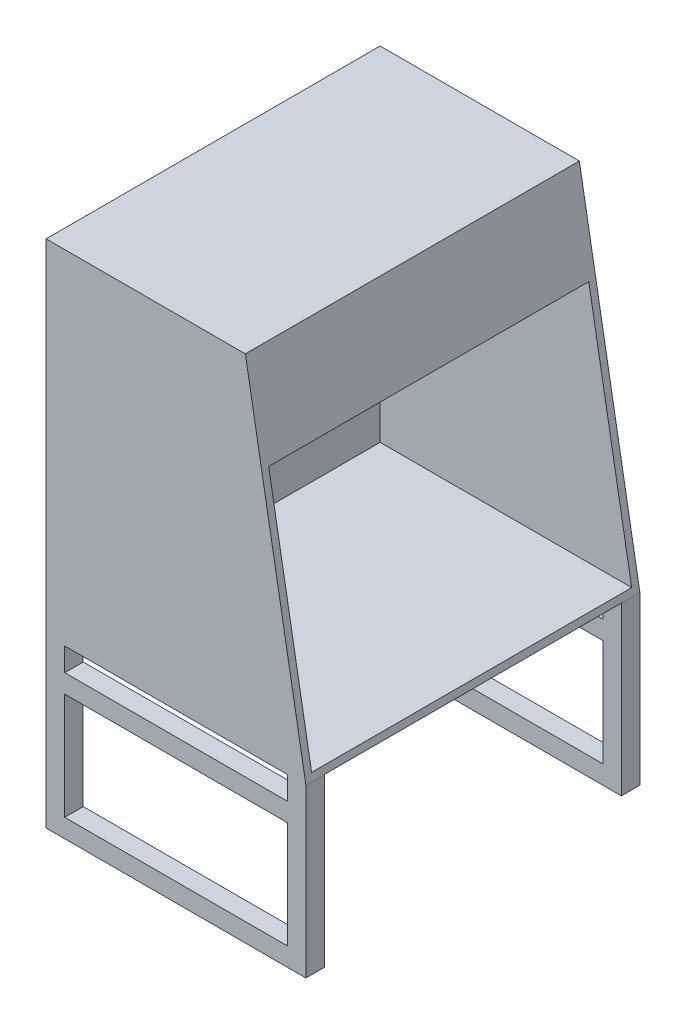
from build123d import *

# Parameters (mm, degrees)
BOSS_EXTRUDE1_DEPTH     = 914.4
SHELL1_T                = -19.05
BOSS_EXTRUDE2_REACH     = 1484.708
SKETCH2_W               = 876.3
SKETCH2_H               = 234.95
SHELL2_START            = 19.05
SHELL2_DEPTH            = 876.3
SKETCH6_W               = 50.8
SKETCH6_H               = 50.8
SKETCH6_W_2             = 25.4
SKETCH6_H_2             = 25.4
BOSS_EXTRUDE3_DEPTH     = 457.2
SKETCH7_W               = 50.8
SKETCH7_H               = 50.8
BOSS_EXTRUDE4_DEPTH     = 609.6
CUT_EXTRUDE2_DEPTH      = 1483.708003115
CUT_EXTRUDE2_DEPTH_BACK = 1483.708003115
SKETCH9_W               = 696
SKETCH9_H               = 388


# Read off the part's stored shape, not the designer's step: Shell2
with BuildPart() as part:
    # Sketch1 → Boss-Extrude1 (new body)
    with BuildSketch(Plane.XY):
        Polygon((0, 0), (711.2, 0), (545.48790353, 939.8), (0, 939.8), align=None)
    extrude(amount=BOSS_EXTRUDE1_DEPTH)

    # Shell1
    shell1_openings = [part.faces().sort_by_distance(p)[0] for p in [
        (628.343951765, 469.9, 457.2),
    ]]
    offset(amount=SHELL1_T, openings=shell1_openings, kind=Kind.INTERSECTION)

    # Boss-Extrude2: up to this plane
    boss_extrude2_end = Plane(origin=(711.2, 0, 914.4), z_dir=(-0.9848077530122075, -0.1736481776669338, 0))
    # Sketch2 → Boss-Extrude2 (add, up to the surface)
    with BuildSketch(Plane(origin=(19.05, 0, 0), x_dir=(0, 0, -1), z_dir=(1, 0, 0)), mode=Mode.PRIVATE) as boss_extrude2_sk1:
        with Locations((-457.2, 803.275)):
            Rectangle(SKETCH2_W, SKETCH2_H)
    boss_extrude2_tool1 = split(extrude(boss_extrude2_sk1.sketch, amount=BOSS_EXTRUDE2_REACH, mode=Mode.PRIVATE), bisect_by=boss_extrude2_end, keep=Keep.BOTH, mode=Mode.PRIVATE)
    add(boss_extrude2_tool1.solids().sort_by_distance((19.05, 803.275, 457.2))[0])

    # Shell2 outline → Shell2 (cut)
    with BuildSketch(Plane.XY.offset(SHELL2_START)):
        Polygon((19.05, 920.75), (19.05, 685.8), (570.931079674, 685.8), (529.503055556, 920.75), align=None)
    extrude(amount=SHELL2_DEPTH, mode=Mode.SUBTRACT)

    # Sketch6 → Boss-Extrude3 (add)
    # profile 1 of 4: a face of its own
    with BuildSketch(Plane.XZ):
        with Locations((685.8, 889)):
            Rectangle(SKETCH6_W, SKETCH6_H)
        with Locations((685.8, 889)):
            Rectangle(SKETCH6_W_2, SKETCH6_H_2, mode=Mode.SUBTRACT)
    # profile 2 of 4: a face of its own
    with BuildSketch(Plane.XZ):
        with Locations((685.8, 25.4)):
            Rectangle(SKETCH6_W, SKETCH6_H)
        with Locations((685.8, 25.4)):
            Rectangle(SKETCH6_W_2, SKETCH6_H_2, mode=Mode.SUBTRACT)
    # profile 3 of 4: a face of its own
    with BuildSketch(Plane.XZ):
        with Locations((25.4, 25.4)):
            Rectangle(SKETCH6_W, SKETCH6_H)
        with Locations((25.4, 25.4)):
            Rectangle(SKETCH6_W_2, SKETCH6_H_2, mode=Mode.SUBTRACT)
    # profile 4 of 4: a face of its own
    with BuildSketch(Plane.XZ):
        with Locations((25.4, 889)):
            Rectangle(SKETCH6_W, SKETCH6_H)
        with Locations((25.4, 889)):
            Rectangle(SKETCH6_W_2, SKETCH6_H_2, mode=Mode.SUBTRACT)
    extrude(amount=BOSS_EXTRUDE3_DEPTH)

    # Sketch7 → Boss-Extrude4 (add)
    with BuildSketch(Plane(origin=(50.8, 0, 0), x_dir=(0, 0, -1), z_dir=(1, 0, 0))):
        with Locations((-889, -431.8)):
            Rectangle(SKETCH7_W, SKETCH7_H)
        with Locations((-25.4, -431.8)):
            Rectangle(SKETCH7_W, SKETCH7_H)
        with Locations((-889, -88.9)):
            Rectangle(SKETCH7_W, SKETCH7_H)
        with Locations((-25.4, -88.9)):
            Rectangle(SKETCH7_W, SKETCH7_H)
    extrude(amount=BOSS_EXTRUDE4_DEPTH)

    # Sketch9 → Cut-Extrude2 (cut, two sides: drawn at the far end of the back side and taken through both)
    with BuildSketch(Plane(origin=(19.05, 0, 0), x_dir=(0, 0, -1), z_dir=(1, 0, 0)).offset(-CUT_EXTRUDE2_DEPTH_BACK)):
        with Locations((-457.4, 388.05)):
            Rectangle(SKETCH9_W, SKETCH9_H)
    extrude(amount=CUT_EXTRUDE2_DEPTH + CUT_EXTRUDE2_DEPTH_BACK, mode=Mode.SUBTRACT)


solid = part.part
